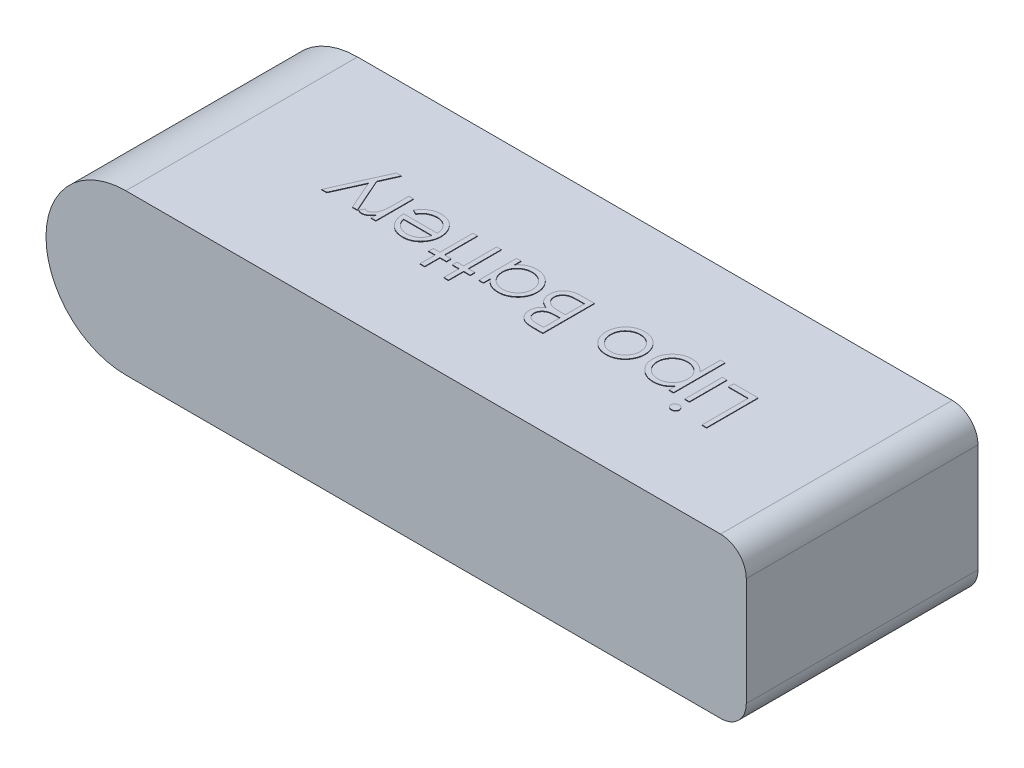
from build123d import *

# Parameters (mm, degrees)
BOSS_EXTRUDE1_DEPTH = 45
FILLET1_R           = 5
SKETCH2_W           = 0.897435898
SKETCH2_H           = 7.307692308
BOSS_EXTRUDE2_DEPTH = 0.1


with BuildPart() as part:
    # Sketch1 → Boss-Extrude1 (new body)
    with BuildSketch(Plane.XY):
        with BuildLine():
            ThreePointArc((0, 15.5), (-15.5, 0), (0, -15.5))
            Line((0, -15.5), (120.5, -15.5))
            Line((120.5, -15.5), (120.5, 15.5))
            Line((120.5, 15.5), (0, 15.5))
        make_face()
    extrude(amount=BOSS_EXTRUDE1_DEPTH)

    # Fillet1
    fillet1_edges = [part.edges().sort_by_distance(p)[0] for p in [
        (120.5, -15.5, 22.5),
        (120.5, 15.5, 22.5),
    ]]
    fillet(fillet1_edges, radius=FILLET1_R)

    # Sketch2 → Boss-Extrude2 (add)
    # profile 1 of 12: a face of its own
    with BuildSketch(Plane(origin=(0, 15.5, 0), x_dir=(-1, 0, 0), z_dir=(0, 1, 0))):
        Polygon((-96.332346914, 28.540798955), (-95.434911017, 28.540798955), (-95.434911017, 19.566439981), (-91.588757171, 19.566439981), (-91.588757171, 18.540798955), (-96.332346914, 18.540798955), align=None)
    # profile 2 of 12: a face of its own
    with BuildSketch(Plane(origin=(0, 15.5, 0), x_dir=(-1, 0, 0), z_dir=(0, 1, 0))):
        with BuildLine():
            add(Edge.make_bspline(
                [(-89.86199435, 28.92541434), (-89.806304876, 28.922831047), (-89.697254191, 28.917772465), (-89.539559141, 28.874453959), (-89.395967678, 28.801026286), (-89.268602726, 28.702512912), (-89.159311622, 28.586657359), (-89.082795306, 28.451626021), (-89.033617032, 28.305744196), (-89.027678302, 28.203986798), (-89.024654606, 28.152177161)],
                knots=[0, 0, 0, 0, 1.055194115, 2.066272739, 3.074728998, 4.095836921, 5.109056067, 6.073838105, 7.019297344, 8, 8, 8, 8], degree=3))
            add(Edge.make_bspline(
                [(-89.024654606, 28.152177161), (-89.027746492, 28.101712437), (-89.033858783, 28.001949651), (-89.082757321, 27.858596874), (-89.159963715, 27.725441779), (-89.268532645, 27.609811178), (-89.395986248, 27.511352264), (-89.539554207, 27.437910152), (-89.697255489, 27.394595474), (-89.806305315, 27.389536364), (-89.86199435, 27.386952802)],
                knots=[0, 0, 0, 0, 0.96129708, 1.900370562, 2.859976407, 3.87933698, 4.906634145, 5.921202961, 6.938410037, 8, 8, 8, 8], degree=3))
            add(Edge.make_bspline(
                [(-89.86199435, 27.386952802), (-89.917046565, 27.389437717), (-90.024198508, 27.394274279), (-90.179532343, 27.438760044), (-90.321899456, 27.511377395), (-90.449512806, 27.609166496), (-90.555884787, 27.726151916), (-90.633308574, 27.858515613), (-90.682094179, 28.001970341), (-90.688221689, 28.101719387), (-90.691321273, 28.152177161)],
                knots=[0, 0, 0, 0, 1.054934014, 2.053291228, 3.073705704, 4.106921865, 5.123545215, 6.088680038, 7.033164197, 8, 8, 8, 8], degree=3))
            add(Edge.make_bspline(
                [(-90.691321273, 28.152177161), (-90.688289597, 28.203979588), (-90.682335194, 28.305722824), (-90.633272005, 28.451708632), (-90.556529697, 28.585941495), (-90.449442373, 28.703157207), (-90.321918201, 28.801001307), (-90.1795275, 28.873604111), (-90.024199788, 28.918093652), (-89.917046999, 28.922929693), (-89.86199435, 28.92541434)],
                knots=[0, 0, 0, 0, 0.98631895, 1.937192651, 2.907499808, 3.917963147, 4.944918757, 5.95915025, 6.951458133, 8, 8, 8, 8], degree=3))
        make_face()
    # profile 3 of 12: a face of its own
    with BuildSketch(Plane(origin=(0, 15.5, 0), x_dir=(-1, 0, 0), z_dir=(0, 1, 0))):
        with Locations((-89.85798794, 22.194645109)):
            Rectangle(SKETCH2_W, SKETCH2_H)
    # profile 4 of 12: a face of its own
    with BuildSketch(Plane(origin=(0, 15.5, 0), x_dir=(-1, 0, 0), z_dir=(0, 1, 0))):
        with BuildLine():
            Line((-87.229782812, 25.848491263), (-86.332346914, 25.848491263))
            Line((-86.332346914, 25.848491263), (-86.332346914, 24.496327802))
            add(Edge.make_bspline(
                [(-86.332346914, 24.496327802), (-86.237039817, 24.619007041), (-86.051829546, 24.857409592), (-85.732615532, 25.165952817), (-85.395681793, 25.42616797), (-85.032357757, 25.630118064), (-84.648290071, 25.783891813), (-84.245054878, 25.897547384), (-83.819229836, 25.964523025), (-83.528097114, 25.972584915), (-83.379622555, 25.976696391)],
                knots=[0, 0, 0, 0, 1.0828784, 2.104357462, 3.088488658, 4.04616522, 5.001424249, 5.969181776, 6.964304535, 8, 8, 8, 8], degree=3))
            add(Edge.make_bspline(
                [(-83.379622555, 25.976696391), (-83.24993226, 25.972944452), (-82.993592579, 25.965528546), (-82.616269068, 25.915319818), (-82.25291083, 25.829269269), (-81.905573533, 25.705266653), (-81.570536203, 25.551965311), (-81.252758775, 25.358488066), (-80.947291474, 25.134470378), (-80.661816648, 24.876664233), (-80.398041312, 24.597726329), (-80.169909366, 24.297662603), (-79.973132496, 23.986340927), (-79.814074506, 23.65893495), (-79.689479228, 23.318022864), (-79.600865863, 22.962227319), (-79.548129739, 22.592867489), (-79.541054163, 22.341716859), (-79.537475119, 22.214677161)],
                knots=[0, 0, 0, 0, 1.041296284, 2.058176809, 3.050446431, 4.034000596, 5.01514041, 6.003636468, 7.015969324, 8.052561599, 9.08815499, 10.094063707, 11.074456064, 12.040834395, 13.011057502, 13.983766392, 14.980127149, 16, 16, 16, 16], degree=3))
            add(Edge.make_bspline(
                [(-79.537475119, 22.214677161), (-79.540976507, 22.084956279), (-79.547881748, 21.82912798), (-79.601438907, 21.45345056), (-79.687029976, 21.092058063), (-79.810053357, 20.745551596), (-79.969029038, 20.414169735), (-80.162470639, 20.09815146), (-80.390717688, 19.797598023), (-80.651578053, 19.516589737), (-80.934586441, 19.257734557), (-81.237093554, 19.031340073), (-81.55440477, 18.841221857), (-81.884896676, 18.682413402), (-82.2313985, 18.562721447), (-82.59229358, 18.476384874), (-82.967385427, 18.423143458), (-83.222531575, 18.416137336), (-83.351577683, 18.412593827)],
                knots=[0, 0, 0, 0, 1.038740735, 2.04854663, 3.033179607, 4.009277356, 4.987731542, 5.972001279, 6.972200261, 8.005528982, 9.039189865, 10.040446548, 11.026516639, 11.997840187, 12.972163198, 13.956796175, 14.96660207, 16, 16, 16, 16], degree=3))
            add(Edge.make_bspline(
                [(-83.351577683, 18.412593827), (-83.496799318, 18.416293278), (-83.783654621, 18.423600777), (-84.203076536, 18.497656235), (-84.606724684, 18.608333194), (-84.990127041, 18.770330318), (-85.356320791, 18.976774649), (-85.703234522, 19.228518095), (-86.032710958, 19.525034166), (-86.231021693, 19.749982212), (-86.332346914, 19.864917545)],
                knots=[0, 0, 0, 0, 1.014726462, 2.004382257, 2.969841629, 3.936926163, 4.907207904, 5.903978561, 6.929055279, 8, 8, 8, 8], degree=3))
            Line((-86.332346914, 19.864917545), (-86.332346914, 15.848491263))
            Line((-86.332346914, 15.848491263), (-87.229782812, 15.848491263))
            Line((-87.229782812, 15.848491263), (-87.229782812, 25.848491263))
        make_face()
        with BuildLine():
            add(Edge.make_bspline(
                [(-83.387635376, 25.079260494), (-83.489291269, 25.077431185), (-83.689425519, 25.073829746), (-83.982774716, 25.031047036), (-84.265333081, 24.968939204), (-84.534252943, 24.874905203), (-84.792111847, 24.759480022), (-85.036923746, 24.615245705), (-85.268516796, 24.444811402), (-85.486308312, 24.251441848), (-85.683060579, 24.038371311), (-85.857240373, 23.81097757), (-86.003546959, 23.5695486), (-86.124981302, 23.316333279), (-86.217390682, 23.04934675), (-86.282978452, 22.770109571), (-86.324208032, 22.478316106), (-86.329604995, 22.279584659), (-86.332346914, 22.178619468)],
                knots=[0, 0, 0, 0, 1.05670511, 2.080379991, 3.077984906, 4.06214886, 5.038337365, 6.01289324, 7.01187578, 8.025460281, 9.038092164, 10.024533457, 11.000252242, 11.969694649, 12.940728589, 13.933144304, 14.949937299, 16, 16, 16, 16], degree=3))
            add(Edge.make_bspline(
                [(-86.332346914, 22.178619468), (-86.327801611, 22.046082004), (-86.318896977, 21.786429886), (-86.246504497, 21.407046681), (-86.128689457, 21.048041951), (-85.961464561, 20.712438988), (-85.750185777, 20.403916602), (-85.495619616, 20.127657726), (-85.20006947, 19.885398895), (-84.868448923, 19.68133817), (-84.512957121, 19.51565798), (-84.142140229, 19.39704595), (-83.761097712, 19.323982441), (-83.503473942, 19.314705815), (-83.37361294, 19.310029725)],
                knots=[0, 0, 0, 0, 1.03728447, 2.032128127, 3.01272805, 3.987917167, 4.958271349, 5.931593992, 6.91984656, 7.941419022, 8.973179163, 9.983609215, 10.983593296, 12, 12, 12, 12], degree=3))
            add(Edge.make_bspline(
                [(-83.37361294, 19.310029725), (-83.246367888, 19.314476516), (-82.993809337, 19.323302597), (-82.62192899, 19.399697418), (-82.260527166, 19.516397488), (-81.917155245, 19.68656765), (-81.594802422, 19.895110673), (-81.303712269, 20.145282196), (-81.049406802, 20.435253462), (-80.832651502, 20.758134899), (-80.657990115, 21.104350281), (-80.526760858, 21.46258282), (-80.451022078, 21.831569743), (-80.440288396, 22.080134637), (-80.434911017, 22.204661135)],
                knots=[0, 0, 0, 0, 1.00104056, 1.986885549, 2.97790532, 3.984399681, 4.995088187, 5.994304198, 6.996462723, 8.023150851, 9.048424203, 10.043036403, 11.019596776, 12, 12, 12, 12], degree=3))
            add(Edge.make_bspline(
                [(-80.434911017, 22.204661135), (-80.439067399, 22.329961104), (-80.447347781, 22.579584829), (-80.528910746, 22.947478837), (-80.651482111, 23.307158769), (-80.83022226, 23.648646054), (-81.042225887, 23.970857718), (-81.298645878, 24.255297373), (-81.586120725, 24.504356438), (-81.908089765, 24.710114752), (-82.253633838, 24.873787594), (-82.61739074, 24.993455134), (-82.997515318, 25.065380133), (-83.256451474, 25.074593008), (-83.387635376, 25.079260494)],
                knots=[0, 0, 0, 0, 0.983928682, 1.960191568, 2.949917689, 3.96440592, 4.982380491, 5.975291189, 6.965713506, 7.964880129, 8.970154049, 9.96478489, 10.968906225, 12, 12, 12, 12], degree=3))
        make_face(mode=Mode.SUBTRACT)
    # profile 5 of 12: a face of its own
    with BuildSketch(Plane(origin=(0, 15.5, 0), x_dir=(-1, 0, 0), z_dir=(0, 1, 0))):
        with BuildLine():
            add(Edge.make_bspline(
                [(-74.212955889, 25.976696391), (-74.075837966, 25.973776702), (-73.80698323, 25.968051906), (-73.413246413, 25.90686629), (-73.037403168, 25.813302391), (-72.678014047, 25.683955071), (-72.339681775, 25.51057807), (-72.01747822, 25.303694381), (-71.712286766, 25.058601256), (-71.529363825, 24.869006775), (-71.436513581, 24.772770109)],
                knots=[0, 0, 0, 0, 1.054011418, 2.066658804, 3.057071809, 4.030435133, 4.997543892, 5.974964718, 6.972108034, 8, 8, 8, 8], degree=3))
            add(Edge.make_bspline(
                [(-71.436513581, 24.772770109), (-71.356565141, 24.68073015), (-71.198215483, 24.498431458), (-70.995170572, 24.202843992), (-70.820251829, 23.896729419), (-70.68007194, 23.576022771), (-70.569543301, 23.243523711), (-70.491069883, 22.898089393), (-70.444392926, 22.540482687), (-70.438098735, 22.297614578), (-70.434911017, 22.174613058)],
                knots=[0, 0, 0, 0, 1.025258237, 2.030674902, 3.01204498, 3.988269485, 4.97094183, 5.956517959, 6.965070386, 8, 8, 8, 8], degree=3))
            add(Edge.make_bspline(
                [(-70.434911017, 22.174613058), (-70.437714838, 22.050898607), (-70.443255318, 21.806433084), (-70.495665651, 21.446377753), (-70.577183039, 21.097249688), (-70.693845434, 20.760510563), (-70.843440032, 20.435131056), (-71.025984853, 20.122532344), (-71.242760902, 19.822097677), (-71.488486608, 19.53637814), (-71.760063397, 19.273046097), (-72.054680963, 19.043536756), (-72.366549631, 18.846903829), (-72.699816355, 18.68851407), (-73.051437746, 18.563629212), (-73.422172226, 18.475914879), (-73.811443855, 18.422881497), (-74.077235916, 18.416071288), (-74.212955889, 18.412593827)],
                knots=[0, 0, 0, 0, 0.998656419, 1.973391657, 2.932242238, 3.890759089, 4.846373663, 5.82037756, 6.809684879, 7.83454468, 8.860553229, 9.859544525, 10.845671541, 11.83227036, 12.833544569, 13.85385346, 14.904124723, 16, 16, 16, 16], degree=3))
            add(Edge.make_bspline(
                [(-74.212955889, 18.412593827), (-74.349340801, 18.416082959), (-74.616457543, 18.422916601), (-75.007103206, 18.475708837), (-75.378502117, 18.563588787), (-75.730583827, 18.688924481), (-76.06528339, 18.846908891), (-76.378959096, 19.04294229), (-76.673815997, 19.273114162), (-76.945450238, 19.536359697), (-77.191160539, 19.822102429), (-77.407940563, 20.122531111), (-77.590484352, 20.435131378), (-77.74007922, 20.760510477), (-77.856741543, 21.097249711), (-77.938258951, 21.446377747), (-77.990669278, 21.806433085), (-77.99620976, 22.050898608), (-77.999013581, 22.174613058)],
                knots=[0, 0, 0, 0, 1.099876186, 2.154163076, 3.173186993, 4.173200201, 5.163417411, 6.152872554, 7.150605724, 8.17532212, 9.198891216, 10.186952605, 11.159729845, 12.11414092, 13.071450619, 14.029093627, 15.002601286, 16, 16, 16, 16], degree=3))
            add(Edge.make_bspline(
                [(-77.999013581, 22.174613058), (-77.995804123, 22.296946046), (-77.989449947, 22.539144339), (-77.942819921, 22.896078798), (-77.864652617, 23.240928481), (-77.753991484, 23.572144127), (-77.61251951, 23.891445372), (-77.440058688, 24.198316318), (-77.234942595, 24.492567177), (-77.077222733, 24.674630262), (-76.997411017, 24.766760494)],
                knots=[0, 0, 0, 0, 1.031353054, 2.041901799, 3.029428768, 4.008703097, 4.981709435, 5.96992636, 6.972712378, 8, 8, 8, 8], degree=3))
            add(Edge.make_bspline(
                [(-76.997411017, 24.766760494), (-76.904700757, 24.863831749), (-76.722369717, 25.054739452), (-76.415659066, 25.299118093), (-76.094248149, 25.510306875), (-75.752176931, 25.680238919), (-75.393083052, 25.814063256), (-75.015313787, 25.907107584), (-74.620240886, 25.967831456), (-74.35007054, 25.973711964), (-74.212955889, 25.976696391)],
                knots=[0, 0, 0, 0, 1.027980169, 2.021703884, 2.998553061, 3.971491411, 4.943284454, 5.930300938, 6.949603206, 8, 8, 8, 8], degree=3))
        make_face()
        with BuildLine():
            add(Edge.make_bspline(
                [(-74.216962299, 25.079260494), (-74.313926903, 25.076504518), (-74.505352984, 25.07106371), (-74.787123226, 25.029681125), (-75.058380809, 24.964116828), (-75.319640364, 24.870962382), (-75.570020856, 24.750679813), (-75.809762006, 24.602941641), (-76.039568977, 24.429704623), (-76.254946301, 24.231239847), (-76.45261005, 24.01444272), (-76.625404269, 23.783447408), (-76.772333144, 23.542000705), (-76.894733599, 23.28985153), (-76.985896993, 23.024444633), (-77.052105629, 22.748785687), (-77.093449173, 22.462313068), (-77.098838826, 22.267567302), (-77.101577683, 22.168603443)],
                knots=[0, 0, 0, 0, 1.021534396, 2.016698045, 2.994645724, 3.958388632, 4.93408049, 5.916473867, 6.921342795, 7.962252576, 8.998418191, 10.008913653, 10.997312074, 11.973003931, 12.956656626, 13.948281152, 14.957379055, 16, 16, 16, 16], degree=3))
            add(Edge.make_bspline(
                [(-77.101577683, 22.168603443), (-77.096986759, 22.040740508), (-77.087874632, 21.786956492), (-77.013773956, 21.413210427), (-76.889813157, 21.054405136), (-76.722420929, 20.712644033), (-76.512688875, 20.396437524), (-76.265582971, 20.114518997), (-75.983755255, 19.871130965), (-75.670565255, 19.669185692), (-75.332410061, 19.508729247), (-74.974534858, 19.395017888), (-74.601275732, 19.321098766), (-74.346187928, 19.313751697), (-74.216962299, 19.310029725)],
                knots=[0, 0, 0, 0, 1.016792936, 2.018143844, 3.017858371, 4.030088057, 5.03801393, 6.028138512, 7.003788237, 7.991172063, 8.984598303, 9.972568034, 10.972917682, 12, 12, 12, 12], degree=3))
            add(Edge.make_bspline(
                [(-74.216962299, 19.310029725), (-74.087744102, 19.313773383), (-73.83267097, 19.321163259), (-73.459930465, 19.394645601), (-73.103033403, 19.509227489), (-72.765229438, 19.669005232), (-72.452182, 19.871897845), (-72.168327368, 20.113144637), (-71.923331336, 20.397184212), (-71.71380675, 20.713062866), (-71.5436732, 21.0538753), (-71.420292623, 21.41327665), (-71.346013806, 21.786939627), (-71.336925724, 22.040734858), (-71.332346914, 22.168603443)],
                knots=[0, 0, 0, 0, 1.02726834, 2.027799167, 3.010890988, 4.004497153, 4.992059811, 5.971914811, 6.958719428, 7.966827853, 8.981595046, 9.981490638, 10.983022906, 12, 12, 12, 12], degree=3))
            add(Edge.make_bspline(
                [(-71.332346914, 22.168603443), (-71.335084829, 22.267567893), (-71.340472626, 22.462314824), (-71.381829667, 22.748778977), (-71.447988352, 23.024469253), (-71.53933583, 23.289760691), (-71.661204441, 23.54265356), (-71.810966707, 23.782738495), (-71.983055351, 24.015242912), (-72.183104267, 24.230539029), (-72.398256776, 24.42978199), (-72.628156885, 24.603008817), (-72.867542538, 24.750030519), (-73.117195631, 24.871991206), (-73.378488682, 24.963269321), (-73.649366194, 25.030059697), (-73.929934222, 25.07088883), (-74.120674345, 25.076452091), (-74.216962299, 25.079260494)],
                knots=[0, 0, 0, 0, 1.042956736, 2.052379634, 3.044323526, 4.02829302, 5.004299113, 5.996692471, 7.007513377, 8.048758398, 9.090003419, 10.095195979, 11.07790575, 12.047570684, 13.018257071, 13.989683339, 14.985167495, 16, 16, 16, 16], degree=3))
        make_face(mode=Mode.SUBTRACT)
    # profile 6 of 12: a face of its own
    with BuildSketch(Plane(origin=(0, 15.5, 0), x_dir=(-1, 0, 0), z_dir=(0, 1, 0))):
        with BuildLine():
            Line((-64.537475119, 28.540798955), (-62.586353324, 28.540798955))
            add(Edge.make_bspline(
                [(-62.586353324, 28.540798955), (-62.490843387, 28.540296811), (-62.305721357, 28.539323531), (-62.036522952, 28.524228871), (-61.784383493, 28.503646957), (-61.549229858, 28.470989549), (-61.331170708, 28.431584472), (-61.129548887, 28.383864997), (-60.945005538, 28.326646101), (-60.724683434, 28.235656726), (-60.473481546, 28.100447674), (-60.201486138, 27.900651773), (-59.968902597, 27.656273307), (-59.768370262, 27.380608578), (-59.608938492, 27.077363515), (-59.493597642, 26.753765833), (-59.420575141, 26.413989428), (-59.413065329, 26.180723205), (-59.409269991, 26.062834212)],
                knots=[0, 0, 0, 0, 1.001505555, 1.941167018, 2.826882275, 3.653841531, 4.429895133, 5.150066043, 5.825578002, 6.45369114, 7.647487171, 8.808567382, 9.977351308, 11.170798116, 12.373658725, 13.556498008, 14.765093433, 16, 16, 16, 16], degree=3))
            add(Edge.make_bspline(
                [(-59.409269991, 26.062834212), (-59.412393472, 25.952398338), (-59.418531408, 25.735381433), (-59.477225006, 25.417969692), (-59.56911263, 25.115823352), (-59.696841913, 24.830045108), (-59.862847617, 24.567091928), (-60.05958567, 24.324842596), (-60.296947963, 24.113553862), (-60.474785791, 23.995431283), (-60.56511935, 23.935430366)],
                knots=[0, 0, 0, 0, 1.044552857, 2.05264487, 3.044412934, 4.028983338, 5.005914585, 5.980388656, 6.974128949, 8, 8, 8, 8], degree=3))
            add(Edge.make_bspline(
                [(-60.56511935, 23.935430366), (-60.451518128, 23.891816083), (-60.23417085, 23.808371156), (-59.935067957, 23.660841259), (-59.6773684, 23.500378086), (-59.45909084, 23.325144229), (-59.272411826, 23.136261912), (-59.109403422, 22.930961586), (-58.970313781, 22.706565135), (-58.851134, 22.465412177), (-58.758137554, 22.209965124), (-58.688492113, 21.94262005), (-58.648585115, 21.664335606), (-58.64290614, 21.474948808), (-58.640039222, 21.379340622)],
                knots=[0, 0, 0, 0, 1.27268992, 2.434971085, 3.483601985, 4.442670788, 5.356604649, 6.2567628, 7.179492994, 8.113709626, 9.066344395, 10.018646069, 10.999752585, 12, 12, 12, 12], degree=3))
            add(Edge.make_bspline(
                [(-58.640039222, 21.379340622), (-58.64283021, 21.281720987), (-58.648321559, 21.089651621), (-58.688835764, 20.807494094), (-58.757433212, 20.53785139), (-58.851922202, 20.278979439), (-58.975243101, 20.031379055), (-59.125322999, 19.794769729), (-59.304270324, 19.571528784), (-59.504449949, 19.359175576), (-59.730913222, 19.16823904), (-59.97524395, 18.998194164), (-60.24051915, 18.858348272), (-60.52238199, 18.740873925), (-60.823994322, 18.651139072), (-61.144001772, 18.58836029), (-61.482128348, 18.546060184), (-61.714156209, 18.542582456), (-61.833148196, 18.540798955)],
                knots=[0, 0, 0, 0, 0.978564426, 1.925352924, 2.850884081, 3.763762016, 4.682927383, 5.618979971, 6.567305752, 7.547517671, 8.540179244, 9.531824382, 10.526200242, 11.540722885, 12.589160233, 13.674978461, 14.80764778, 16, 16, 16, 16], degree=3))
            Line((-61.833148196, 18.540798955), (-64.537475119, 18.540798955))
            Line((-64.537475119, 18.540798955), (-64.537475119, 28.540798955))
        make_face()
        with BuildLine():
            Line((-63.640039222, 27.51515793), (-63.640039222, 24.310029725))
            Line((-63.640039222, 24.310029725), (-63.037074478, 24.310029725))
            add(Edge.make_bspline(
                [(-63.037074478, 24.310029725), (-62.948935063, 24.311172362), (-62.778631751, 24.31338017), (-62.532003475, 24.319704504), (-62.303074851, 24.3374132), (-62.092241043, 24.355116805), (-61.89983406, 24.383901342), (-61.72628017, 24.41816455), (-61.568855607, 24.454401422), (-61.387314049, 24.516028527), (-61.181391339, 24.607107599), (-60.961868184, 24.748455702), (-60.768341128, 24.916810997), (-60.604920592, 25.111070888), (-60.471173533, 25.324974276), (-60.378277204, 25.55510822), (-60.315284963, 25.795737169), (-60.309594874, 25.960932177), (-60.306705889, 26.044805366)],
                knots=[0, 0, 0, 0, 1.156816544, 2.235205308, 3.236616184, 4.169592532, 5.011045266, 5.787822928, 6.49130361, 7.128639758, 8.301311294, 9.436451833, 10.541879658, 11.654887649, 12.756523258, 13.837046038, 14.901820046, 16, 16, 16, 16], degree=3))
            add(Edge.make_bspline(
                [(-60.306705889, 26.044805366), (-60.30820926, 26.10030757), (-60.311158289, 26.209181205), (-60.335310582, 26.367893645), (-60.376360795, 26.517161509), (-60.429087347, 26.659030396), (-60.502769314, 26.789064254), (-60.589522067, 26.911759099), (-60.694338325, 27.02293658), (-60.813644932, 27.126849432), (-60.950812426, 27.218976655), (-61.105758974, 27.299664549), (-61.280580909, 27.364638197), (-61.472331923, 27.42154149), (-61.683963601, 27.461508044), (-61.913033754, 27.494803437), (-62.161418666, 27.511754128), (-62.333261816, 27.513998022), (-62.422090504, 27.51515793)],
                knots=[0, 0, 0, 0, 0.91205012, 1.789085906, 2.630437955, 3.453916878, 4.269457761, 5.079663411, 5.91843418, 6.774407191, 7.675494373, 8.627863946, 9.638891023, 10.736472738, 11.911756761, 13.175263542, 14.539845004, 16, 16, 16, 16], degree=3))
            Line((-62.422090504, 27.51515793), (-63.640039222, 27.51515793))
        make_face(mode=Mode.SUBTRACT)
        with BuildLine():
            Line((-63.640039222, 23.284388699), (-63.640039222, 19.566439981))
            Line((-63.640039222, 19.566439981), (-62.36199435, 19.566439981))
            add(Edge.make_bspline(
                [(-62.36199435, 19.566439981), (-62.270511705, 19.567536402), (-62.094190966, 19.569649609), (-61.839616023, 19.576548337), (-61.603664297, 19.592240553), (-61.387412481, 19.616942981), (-61.188525474, 19.64373855), (-61.009389179, 19.679770781), (-60.848551484, 19.721053525), (-60.662053461, 19.784865446), (-60.452043438, 19.88399822), (-60.225726705, 20.033467438), (-60.024508939, 20.211534032), (-59.85363677, 20.417622358), (-59.71359966, 20.641711864), (-59.611726931, 20.879270006), (-59.548895912, 21.126371513), (-59.541289714, 21.294847835), (-59.537475119, 21.379340622)],
                knots=[0, 0, 0, 0, 1.160039823, 2.235823828, 3.228722157, 4.157150951, 4.99529583, 5.772374946, 6.472645482, 7.099169577, 8.269452708, 9.405989375, 10.527446681, 11.663510218, 12.788923519, 13.866172445, 14.929861265, 16, 16, 16, 16], degree=3))
            add(Edge.make_bspline(
                [(-59.537475119, 21.379340622), (-59.538263989, 21.432178738), (-59.539829003, 21.537002686), (-59.56343076, 21.691047883), (-59.597756103, 21.840264664), (-59.642131628, 21.985058209), (-59.706758677, 22.122810712), (-59.782205948, 22.256246597), (-59.870667096, 22.385542252), (-60.00850757, 22.549005834), (-60.208998954, 22.737340156), (-60.493875455, 22.92173302), (-60.817796307, 23.07044104), (-61.052732001, 23.133582401), (-61.174093709, 23.166199596)],
                knots=[0, 0, 0, 0, 0.723448775, 1.435228256, 2.130040452, 2.821711965, 3.505591119, 4.210454504, 4.921174351, 5.648778258, 7.137944449, 8.670945889, 10.280296675, 12, 12, 12, 12], degree=3))
            add(Edge.make_bspline(
                [(-61.174093709, 23.166199596), (-61.222748269, 23.176071265), (-61.32824139, 23.197475078), (-61.500263048, 23.220068517), (-61.696651245, 23.240197259), (-61.917859465, 23.255086281), (-62.164167583, 23.270476405), (-62.436101636, 23.276461609), (-62.732551107, 23.283602352), (-62.938243599, 23.284119878), (-63.045087299, 23.284388699)],
                knots=[0, 0, 0, 0, 0.634451884, 1.375622551, 2.216452059, 3.157844607, 4.20941857, 5.370758133, 6.634282058, 8, 8, 8, 8], degree=3))
            Line((-63.045087299, 23.284388699), (-63.640039222, 23.284388699))
        make_face(mode=Mode.SUBTRACT)
    # profile 7 of 12: a face of its own
    with BuildSketch(Plane(origin=(0, 15.5, 0), x_dir=(-1, 0, 0), z_dir=(0, 1, 0))):
        with BuildLine():
            Line((-49.409269991, 25.848491263), (-49.409269991, 18.540798955))
            Line((-49.409269991, 18.540798955), (-50.306705889, 18.540798955))
            Line((-50.306705889, 18.540798955), (-50.306705889, 19.804821391))
            add(Edge.make_bspline(
                [(-50.306705889, 19.804821391), (-50.407902433, 19.690422551), (-50.605388763, 19.467171777), (-50.935220528, 19.175508427), (-51.284843894, 18.934427508), (-51.652561954, 18.739713463), (-52.038042649, 18.593450445), (-52.44043147, 18.489489991), (-52.859892558, 18.422650462), (-53.146327858, 18.415976113), (-53.29148153, 18.412593827)],
                knots=[0, 0, 0, 0, 1.074387032, 2.096679803, 3.090159297, 4.057316773, 5.018401886, 5.985159533, 6.978961417, 8, 8, 8, 8], degree=3))
            add(Edge.make_bspline(
                [(-53.29148153, 18.412593827), (-53.420532826, 18.416097748), (-53.675027697, 18.423007635), (-54.049396489, 18.476614217), (-54.409660059, 18.562701707), (-54.756158838, 18.682418534), (-55.086650682, 18.841220882), (-55.403965244, 19.031338733), (-55.70645865, 19.257741105), (-55.98952019, 19.516564043), (-56.250183048, 19.797692578), (-56.478929541, 20.097536998), (-56.669652626, 20.414800723), (-56.829138571, 20.745466877), (-56.95198527, 21.092080933), (-57.037624225, 21.45344427), (-57.091168358, 21.829129623), (-57.098075389, 22.084956832), (-57.101577683, 22.214677161)],
                knots=[0, 0, 0, 0, 1.033919861, 2.038935746, 3.024066025, 3.998881131, 4.97069526, 5.957263378, 6.95902576, 7.993208707, 9.027059324, 10.027763471, 11.009749337, 11.988697705, 12.965288445, 13.950418724, 14.960734635, 16, 16, 16, 16], degree=3))
            add(Edge.make_bspline(
                [(-57.101577683, 22.214677161), (-57.097997765, 22.341716314), (-57.09092046, 22.592865866), (-57.038196975, 22.962233574), (-56.94953695, 23.318000034), (-56.825114528, 23.659019872), (-56.665566085, 23.985705729), (-56.471485837, 24.298288658), (-56.242859766, 24.597629793), (-55.97928146, 24.876690441), (-55.693753546, 25.134463625), (-55.388300029, 25.358489469), (-55.070519225, 25.55196618), (-54.735482052, 25.705261827), (-54.388147467, 25.82928784), (-54.025423336, 25.91509632), (-53.648818826, 25.965660095), (-53.393131705, 25.972982278), (-53.263436658, 25.976696391)],
                knots=[0, 0, 0, 0, 1.020392517, 2.01726096, 2.990465484, 3.961182959, 4.928053699, 5.906110375, 6.912531644, 7.948652711, 8.985773172, 9.998621852, 10.987621588, 11.969261332, 12.953316658, 13.946091881, 14.958173133, 16, 16, 16, 16], degree=3))
            add(Edge.make_bspline(
                [(-53.263436658, 25.976696391), (-53.114294203, 25.97258853), (-52.821832889, 25.964533207), (-52.394038577, 25.897496843), (-51.989340069, 25.78424408), (-51.604613348, 25.630194086), (-51.24123996, 25.425483431), (-50.902660004, 25.167254971), (-50.585330052, 24.857137294), (-50.401386362, 24.618936024), (-50.306705889, 24.496327802)],
                knots=[0, 0, 0, 0, 1.038897134, 2.037228247, 3.008116434, 3.962042015, 4.918381754, 5.904844433, 6.921570401, 8, 8, 8, 8], degree=3))
            Line((-50.306705889, 24.496327802), (-50.306705889, 25.848491263))
            Line((-50.306705889, 25.848491263), (-49.409269991, 25.848491263))
        make_face()
        with BuildLine():
            add(Edge.make_bspline(
                [(-53.251417427, 25.079260494), (-53.382601249, 25.074592958), (-53.641537249, 25.065379983), (-54.02166297, 24.993455711), (-54.385415581, 24.873785442), (-54.730975793, 24.710122867), (-55.052884984, 24.504326476), (-55.340581186, 24.255408238), (-55.596417476, 23.970159627), (-55.811583945, 23.649867883), (-55.986985365, 23.306501908), (-56.110319742, 22.947574942), (-56.191660449, 22.579560721), (-56.199970507, 22.329953047), (-56.204141786, 22.204661135)],
                knots=[0, 0, 0, 0, 1.031046209, 2.035121221, 3.029706178, 4.034933723, 5.034054252, 6.02443088, 7.017295772, 8.038157696, 9.050218397, 10.03989886, 11.016116709, 12, 12, 12, 12], degree=3))
            add(Edge.make_bspline(
                [(-56.204141786, 22.204661135), (-56.198813519, 22.080117972), (-56.188177871, 21.831519812), (-56.111747316, 21.463003878), (-55.983519106, 21.10399233), (-55.808541784, 20.757532348), (-55.589437142, 20.43586349), (-55.335469563, 20.145177425), (-55.044183045, 19.895207173), (-54.721533025, 19.685956963), (-54.376938824, 19.516921189), (-54.014556162, 19.399305076), (-53.641197196, 19.32336856), (-53.387333385, 19.314498626), (-53.259430247, 19.310029725)],
                knots=[0, 0, 0, 0, 0.979072187, 1.954306742, 2.945804271, 3.96968567, 4.997920485, 5.998718438, 6.996577872, 8.005894225, 9.015743152, 10.005417472, 10.995077863, 12, 12, 12, 12], degree=3))
            add(Edge.make_bspline(
                [(-53.259430247, 19.310029725), (-53.129583097, 19.314772479), (-52.871329992, 19.324205346), (-52.490076541, 19.396437533), (-52.120090933, 19.515776957), (-51.766413138, 19.681203033), (-51.436938478, 19.88622405), (-51.141230256, 20.12624431), (-50.891184632, 20.405396265), (-50.679205747, 20.71218613), (-50.512990271, 21.04850612), (-50.391915816, 21.406603808), (-50.320333228, 21.78649166), (-50.311311144, 22.04610288), (-50.306705889, 22.178619468)],
                knots=[0, 0, 0, 0, 1.01762866, 2.023962475, 3.030623092, 4.058876274, 5.077231937, 6.066672613, 7.034107872, 8.005628644, 8.981990164, 9.965428785, 10.961468474, 12, 12, 12, 12], degree=3))
            add(Edge.make_bspline(
                [(-50.306705889, 22.178619468), (-50.309447764, 22.279584698), (-50.314844642, 22.478316222), (-50.356074841, 22.770109129), (-50.421660345, 23.049348347), (-50.514077974, 23.316327458), (-50.635481643, 23.569570359), (-50.781903832, 23.810895389), (-50.955919402, 24.039047421), (-51.154727105, 24.250884767), (-51.37234197, 24.44410323), (-51.602612086, 24.61657249), (-51.848265649, 24.758254697), (-52.105171468, 24.875515473), (-52.373775281, 24.96882733), (-52.656262766, 25.031077884), (-52.9496313, 25.073821658), (-53.149762887, 25.07742846), (-53.251417427, 25.079260494)],
                knots=[0, 0, 0, 0, 1.050140795, 2.067009409, 3.05949893, 4.030605086, 5.00011959, 5.97591094, 6.962425594, 7.979863591, 8.993523472, 9.986985069, 10.967611495, 11.937549037, 12.921786183, 13.919465291, 14.943216303, 16, 16, 16, 16], degree=3))
        make_face(mode=Mode.SUBTRACT)
    # profile 8 of 12: a face of its own
    with BuildSketch(Plane(origin=(0, 15.5, 0), x_dir=(-1, 0, 0), z_dir=(0, 1, 0))):
        Polygon((-46.460552042, 28.797209212), (-45.563116145, 28.797209212), (-45.563116145, 25.848491263), (-44.281064863, 25.848491263), (-44.281064863, 24.951055366), (-45.563116145, 24.951055366), (-45.563116145, 18.540798955), (-46.460552042, 18.540798955), (-46.460552042, 24.951055366), (-47.742603324, 24.951055366), (-47.742603324, 25.848491263), (-46.460552042, 25.848491263), align=None)
    # profile 9 of 12: a face of its own
    with BuildSketch(Plane(origin=(0, 15.5, 0), x_dir=(-1, 0, 0), z_dir=(0, 1, 0))):
        Polygon((-41.845167427, 28.797209212), (-40.94773153, 28.797209212), (-40.94773153, 25.848491263), (-39.665680247, 25.848491263), (-39.665680247, 24.951055366), (-40.94773153, 24.951055366), (-40.94773153, 18.540798955), (-41.845167427, 18.540798955), (-41.845167427, 24.951055366), (-43.127218709, 24.951055366), (-43.127218709, 25.848491263), (-41.845167427, 25.848491263), align=None)
    # profile 10 of 12: a face of its own
    with BuildSketch(Plane(origin=(0, 15.5, 0), x_dir=(-1, 0, 0), z_dir=(0, 1, 0))):
        with BuildLine():
            Line((-32.129622555, 20.848491263), (-31.332346914, 20.429821391))
            add(Edge.make_bspline(
                [(-31.332346914, 20.429821391), (-31.395880043, 20.317126159), (-31.519490353, 20.097865865), (-31.732063919, 19.796631978), (-31.954898412, 19.525638504), (-32.198052606, 19.292125207), (-32.454251689, 19.088549821), (-32.724916417, 18.91044175), (-33.011455896, 18.758674549), (-33.313883681, 18.630810184), (-33.634739542, 18.532497344), (-33.974801017, 18.463056712), (-34.334719575, 18.420133088), (-34.581422946, 18.415146971), (-34.707747555, 18.412593827)],
                knots=[0, 0, 0, 0, 1.120438281, 2.179929193, 3.190490725, 4.156257408, 5.095198341, 6.022838206, 6.959905092, 7.901321166, 8.864066838, 9.862729781, 10.905609505, 12, 12, 12, 12], degree=3))
            add(Edge.make_bspline(
                [(-34.707747555, 18.412593827), (-34.848153205, 18.415871471), (-35.122043953, 18.422265205), (-35.520728945, 18.477386531), (-35.896098711, 18.567307556), (-36.24813215, 18.692923389), (-36.575967157, 18.857001458), (-36.880255314, 19.056885692), (-37.162596816, 19.291549277), (-37.414094557, 19.563024829), (-37.64050565, 19.853544707), (-37.840293707, 20.156275806), (-38.007314939, 20.470456447), (-38.143179539, 20.794086516), (-38.252907725, 21.125126212), (-38.329384021, 21.466587548), (-38.373469016, 21.81754636), (-38.380224574, 22.054967319), (-38.383628965, 22.174613058)],
                knots=[0, 0, 0, 0, 1.145258523, 2.234067595, 3.276747158, 4.290159414, 5.277019952, 6.260822364, 7.254936242, 8.264827045, 9.274100331, 10.257902744, 11.220704747, 12.172965371, 13.118907548, 14.062713208, 15.023725156, 16, 16, 16, 16], degree=3))
            add(Edge.make_bspline(
                [(-38.383628965, 22.174613058), (-38.380602847, 22.286884002), (-38.374605481, 22.509390187), (-38.336803231, 22.838720314), (-38.269808108, 23.158801607), (-38.177875754, 23.46990003), (-38.059157908, 23.771494698), (-37.913922996, 24.063769166), (-37.741944773, 24.346412423), (-37.609165706, 24.52470709), (-37.542282812, 24.614516904)],
                knots=[0, 0, 0, 0, 1.024358464, 2.0301432, 3.019427413, 4.004406732, 4.986367066, 5.972626655, 6.978780325, 8, 8, 8, 8], degree=3))
            add(Edge.make_bspline(
                [(-37.542282812, 24.614516904), (-37.451689432, 24.722713676), (-37.273372442, 24.93567982), (-36.971782855, 25.215503608), (-36.645210866, 25.449914394), (-36.297749077, 25.644220497), (-35.925359151, 25.791859489), (-35.533046891, 25.901881152), (-35.116345216, 25.963532612), (-34.831473156, 25.972240708), (-34.685712299, 25.976696391)],
                knots=[0, 0, 0, 0, 1.030682036, 2.02871468, 2.997146059, 3.962720338, 4.930598197, 5.918074684, 6.934738563, 8, 8, 8, 8], degree=3))
            add(Edge.make_bspline(
                [(-34.685712299, 25.976696391), (-34.535861998, 25.97282768), (-34.241889867, 25.965238151), (-33.813226664, 25.894877198), (-33.407624616, 25.783298471), (-33.025246033, 25.625716212), (-32.666052145, 25.422403207), (-32.332377717, 25.170569374), (-32.018516253, 24.877946268), (-31.835920313, 24.652908527), (-31.743003965, 24.538395109)],
                knots=[0, 0, 0, 0, 1.056321875, 2.072262726, 3.055038591, 4.01806755, 4.982017516, 5.957941055, 6.960871419, 8, 8, 8, 8], degree=3))
            add(Edge.make_bspline(
                [(-31.743003965, 24.538395109), (-31.679784142, 24.452099162), (-31.553765304, 24.28008168), (-31.395916447, 23.99959266), (-31.258895318, 23.706133819), (-31.149372573, 23.394961542), (-31.060688284, 23.069762741), (-30.996525944, 22.728212614), (-30.958898463, 22.370412867), (-30.951502185, 22.126622708), (-30.94773153, 22.002337417)],
                knots=[0, 0, 0, 0, 0.94817472, 1.890038105, 2.849395472, 3.817997239, 4.812318967, 5.836947057, 6.897266129, 8, 8, 8, 8], degree=3))
            Line((-30.94773153, 22.002337417), (-37.486193068, 22.002337417))
            add(Edge.make_bspline(
                [(-37.486193068, 22.002337417), (-37.481794192, 21.906050376), (-37.473143981, 21.716705794), (-37.432815001, 21.439646414), (-37.369247076, 21.175722579), (-37.279906897, 20.926913888), (-37.17171591, 20.689970666), (-37.039185291, 20.466650561), (-36.88107228, 20.257970761), (-36.704713138, 20.062064653), (-36.508407152, 19.887605336), (-36.301885017, 19.731457403), (-36.082189117, 19.60058427), (-35.851051735, 19.494356013), (-35.608846635, 19.41119511), (-35.355497506, 19.354429908), (-35.091502888, 19.316409603), (-34.911543648, 19.312181988), (-34.819927042, 19.310029725)],
                knots=[0, 0, 0, 0, 1.094153842, 2.151609401, 3.174256925, 4.172055639, 5.149267565, 6.128595816, 7.11444997, 8.118368179, 9.117203808, 10.09244225, 11.054858984, 12.015122123, 12.976791628, 13.957293641, 14.960065497, 16, 16, 16, 16], degree=3))
            add(Edge.make_bspline(
                [(-34.819927042, 19.310029725), (-34.730352335, 19.311767029), (-34.552618932, 19.315214175), (-34.287930768, 19.348733921), (-34.027532119, 19.402934708), (-33.772500738, 19.476906108), (-33.528012607, 19.567125686), (-33.301596749, 19.675990993), (-33.093367562, 19.796418841), (-32.898747657, 19.93416077), (-32.709973391, 20.10275559), (-32.522709144, 20.313143364), (-32.321918706, 20.561964872), (-32.196234155, 20.749238204), (-32.129622555, 20.848491263)],
                knots=[0, 0, 0, 0, 0.99110716, 1.966546729, 2.947904876, 3.932708344, 4.903319531, 5.828989031, 6.710028674, 7.56322171, 8.463672341, 9.504779593, 10.677557249, 12, 12, 12, 12], degree=3))
        make_face()
        with BuildLine():
            add(Edge.make_bspline(
                [(-31.845167427, 22.899773314), (-31.878014926, 23.018810096), (-31.941235787, 23.247917584), (-32.073339685, 23.565177271), (-32.222115516, 23.847142702), (-32.398177606, 24.09165594), (-32.597659679, 24.308808834), (-32.828074486, 24.49857622), (-33.086462754, 24.668340366), (-33.37148887, 24.811633222), (-33.673322541, 24.933604246), (-33.989340233, 25.015390291), (-34.311791055, 25.071417555), (-34.529889016, 25.076635008), (-34.639638581, 25.079260494)],
                knots=[0, 0, 0, 0, 1.154881502, 2.222775134, 3.210006277, 4.132804581, 5.035138423, 5.962687519, 6.919655026, 7.923214229, 8.944639381, 9.960483929, 10.97369054, 12, 12, 12, 12], degree=3))
            add(Edge.make_bspline(
                [(-34.639638581, 25.079260494), (-34.729208405, 25.077512861), (-34.906269117, 25.074058158), (-35.167129312, 25.04128636), (-35.417642737, 24.987115374), (-35.659657845, 24.912929784), (-35.890003183, 24.814048063), (-36.113416806, 24.698095987), (-36.324217938, 24.556548604), (-36.456050211, 24.448666162), (-36.522651401, 24.39416434)],
                knots=[0, 0, 0, 0, 1.04873581, 2.073130211, 3.073294108, 4.04793562, 5.032784715, 6.005352987, 6.992311501, 8, 8, 8, 8], degree=3))
            add(Edge.make_bspline(
                [(-36.522651401, 24.39416434), (-36.570346493, 24.351037724), (-36.666869733, 24.263759964), (-36.795842652, 24.113390802), (-36.919329717, 23.951243482), (-37.031711582, 23.771114554), (-37.1347904, 23.575055186), (-37.231247478, 23.364719085), (-37.318065798, 23.138510141), (-37.366911827, 22.980874601), (-37.392042427, 22.899773314)],
                knots=[0, 0, 0, 0, 0.879870761, 1.780643979, 2.707998968, 3.669668524, 4.684282772, 5.740141944, 6.837334558, 8, 8, 8, 8], degree=3))
            Line((-37.392042427, 22.899773314), (-31.845167427, 22.899773314))
        make_face(mode=Mode.SUBTRACT)
    # profile 11 of 12: a face of its own
    with BuildSketch(Plane(origin=(0, 15.5, 0), x_dir=(-1, 0, 0), z_dir=(0, 1, 0))):
        with BuildLine():
            Line((-29.409269991, 25.848491263), (-28.511834094, 25.848491263))
            Line((-28.511834094, 25.848491263), (-28.511834094, 24.772770109))
            add(Edge.make_bspline(
                [(-28.511834094, 24.772770109), (-28.445580497, 24.872929619), (-28.318871009, 25.064483902), (-28.108262639, 25.317824762), (-27.892538836, 25.527582038), (-27.670666872, 25.694734949), (-27.441015158, 25.819915289), (-27.208623867, 25.911609675), (-26.96983681, 25.965830575), (-26.80937417, 25.973069601), (-26.72898153, 25.976696391)],
                knots=[0, 0, 0, 0, 1.2804753, 2.448899062, 3.506932113, 4.484331642, 5.4025378, 6.288909075, 7.142734305, 8, 8, 8, 8], degree=3))
            add(Edge.make_bspline(
                [(-26.72898153, 25.976696391), (-26.666620597, 25.973294887), (-26.538308925, 25.96629607), (-26.344072954, 25.917122285), (-26.143948806, 25.83861365), (-26.014970556, 25.764784442), (-25.94773153, 25.72629575)],
                knots=[0, 0, 0, 0, 0.901110191, 1.854092781, 2.881294221, 4, 4, 4, 4], degree=3))
            Line((-25.94773153, 25.72629575), (-26.440519991, 24.949052161))
            add(Edge.make_bspline(
                [(-26.440519991, 24.949052161), (-26.483688623, 24.968310064), (-26.56563095, 25.004865251), (-26.685501139, 25.048128137), (-26.796019244, 25.073602182), (-26.866429411, 25.077461375), (-26.899253965, 25.079260494)],
                knots=[0, 0, 0, 0, 1.180555205, 2.24091978, 3.179933427, 4, 4, 4, 4], degree=3))
            add(Edge.make_bspline(
                [(-26.899253965, 25.079260494), (-26.971270347, 25.074460387), (-27.11816289, 25.064669561), (-27.333832888, 24.987701539), (-27.543110618, 24.86334371), (-27.709315367, 24.725426247), (-27.838007519, 24.59243254), (-27.929836734, 24.476294247), (-28.014073154, 24.346069586), (-28.094559498, 24.203984775), (-28.167891767, 24.047613786), (-28.236333679, 23.878518891), (-28.298216145, 23.696504237), (-28.333502557, 23.569697036), (-28.351577683, 23.504741263)],
                knots=[0, 0, 0, 0, 1.125678352, 2.296057538, 3.5422874, 4.923748041, 5.663163013, 6.437101912, 7.23742474, 8.08941207, 8.991984279, 9.93940061, 10.944477711, 12, 12, 12, 12], degree=3))
            add(Edge.make_bspline(
                [(-28.351577683, 23.504741263), (-28.365098807, 23.446806481), (-28.395047069, 23.318485342), (-28.424165749, 23.103203843), (-28.4529358, 22.848850533), (-28.473211853, 22.55471741), (-28.492006259, 22.221538999), (-28.502606494, 21.848807726), (-28.511472609, 21.436141008), (-28.511709943, 21.147642856), (-28.511834094, 20.996728443)],
                knots=[0, 0, 0, 0, 0.566838948, 1.255505196, 2.06880316, 3.007127437, 4.065329342, 5.249902469, 6.561414163, 8, 8, 8, 8], degree=3))
            Line((-28.511834094, 20.996728443), (-28.511834094, 18.540798955))
            Line((-28.511834094, 18.540798955), (-29.409269991, 18.540798955))
            Line((-29.409269991, 18.540798955), (-29.409269991, 25.848491263))
        make_face()
    # profile 12 of 12: a face of its own
    with BuildSketch(Plane(origin=(0, 15.5, 0), x_dir=(-1, 0, 0), z_dir=(0, 1, 0))):
        Polygon((-25.819526401, 25.848491263), (-24.851978324, 25.848491263), (-22.378019991, 20.251536135), (-19.86600076, 25.848491263), (-18.896449478, 25.848491263), (-23.383628965, 15.848491263), (-24.353180247, 15.848491263), (-22.864798837, 19.16379575), align=None)
    extrude(amount=BOSS_EXTRUDE2_DEPTH)


solid = part.part
